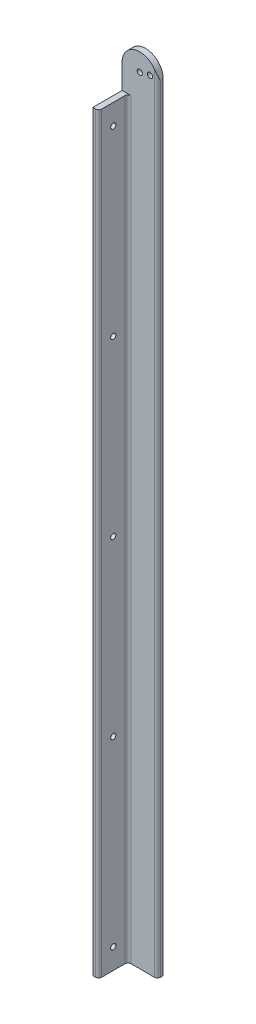
from build123d import *

# Parameters (mm, degrees)
BOSS_EXTRUDE1_DEPTH = 431.8
SKETCH4_W           = 15.875
SKETCH4_H           = 25.4
CUT_EXTRUDE1_DEPTH  = 6.35
SKETCH5_W           = 1.5875
SKETCH5_H           = 25.4
CUT_EXTRUDE2_DEPTH  = 6.35
SKETCH6_R           = 1.4224
CUT_EXTRUDE3_DEPTH  = 5.08
CUT_EXTRUDE4_START  = -2.54
CUT_EXTRUDE4_DEPTH  = 2.54
SKETCH8_R           = 1.4224
CUT_EXTRUDE5_DEPTH  = 5.08
SKETCH9_W           = 28.861002292
SKETCH9_H           = 547.524656259
CUT_EXTRUDE6_DEPTH  = 30.48
CUT_EXTRUDE7_DEPTH  = 5.08


with BuildPart() as part:
    # Sketch2 → Boss-Extrude1 (new body)
    with BuildSketch(Plane(origin=(0, 0, 0), x_dir=(1, 0, 0), z_dir=(0, 1, 0))):
        with BuildLine():
            Line((0, 0), (19.05, 0))
            Line((19.05, 0), (19.05, 1.5875))
            ThreePointArc((19.05, 1.5875), (18.585032015, 2.710032015), (17.4625, 3.175))
            Line((17.4625, 3.175), (4.7625, 3.175))
            ThreePointArc((4.7625, 3.175), (3.639967985, 3.639967985), (3.175, 4.7625))
            Line((3.175, 4.7625), (3.175, 17.4625))
            ThreePointArc((3.175, 17.4625), (2.710032015, 18.585032015), (1.5875, 19.05))
            Line((1.5875, 19.05), (0, 19.05))
            Line((0, 19.05), (0, 0))
        make_face()
    extrude(amount=BOSS_EXTRUDE1_DEPTH)

    # Sketch4 → Cut-Extrude1 (cut)
    with BuildSketch(Plane(origin=(3.175, 0, 0), x_dir=(0, 0, -1), z_dir=(1, 0, 0))):
        with Locations((11.1125, 419.1)):
            Rectangle(SKETCH4_W, SKETCH4_H)
    extrude(amount=-CUT_EXTRUDE1_DEPTH, mode=Mode.SUBTRACT)

    # Sketch5 → Cut-Extrude2 (cut)
    with BuildSketch(Plane.ZY.offset(-3.175)):
        with Locations((-3.96875, 419.1)):
            Rectangle(SKETCH5_W, SKETCH5_H)
    extrude(amount=-CUT_EXTRUDE2_DEPTH, mode=Mode.SUBTRACT)

    # Sketch6 → Cut-Extrude3 (cut)
    with BuildSketch(Plane(origin=(3.175, 0, 0), x_dir=(0, 0, -1), z_dir=(1, 0, 0))):
        with Locations((11.1125, 109.5375)):
            Circle(SKETCH6_R)
        with Locations((11.1125, 203.2)):
            Circle(SKETCH6_R)
        with Locations((11.1125, 296.8625)):
            Circle(SKETCH6_R)
        with Locations((11.1125, 11.1125)):
            Circle(SKETCH6_R)
        with Locations((11.1125, 395.2875)):
            Circle(SKETCH6_R)
    extrude(amount=-CUT_EXTRUDE3_DEPTH, mode=Mode.SUBTRACT)

    # Sketch7 → Cut-Extrude4 (cut)
    with BuildSketch(Plane(origin=(0, 431.8, 0), x_dir=(1, 0, 0), z_dir=(0, 1, 0)).offset(CUT_EXTRUDE4_START)):
        with BuildLine():
            Line((17.4625, 3.175), (0, 3.175))
            Line((0, 3.175), (0, 0))
            Line((0, 0), (19.05, 0))
            Line((19.05, 0), (19.05, 1.5875))
            ThreePointArc((19.05, 1.5875), (18.585032015, 2.710032015), (17.4625, 3.175))
        make_face()
    extrude(amount=CUT_EXTRUDE4_DEPTH, mode=Mode.SUBTRACT)

    # Sketch8 → Cut-Extrude5 (cut)
    with BuildSketch(Plane(origin=(0, 0, -3.175), x_dir=(-1, 0, 0), z_dir=(0, 0, -1))):
        with Locations((-9.525, 419.735)):
            Circle(SKETCH8_R)
        with Locations((-15.09352492, 421.020595276)):
            Circle(SKETCH8_R)
    extrude(amount=-CUT_EXTRUDE5_DEPTH, mode=Mode.SUBTRACT)


with BuildPart() as body_2:
    # Mirror3: mirrored copy
    add(part.part.mirror(Plane.XY.offset(2.54)))

    # Sketch10 → Cut-Extrude7 (cut)
    with BuildSketch(Plane.XY.offset(8.255)):
        with BuildLine():
            Line((19.05, 419.735), (19.05, 429.26))
            Line((19.05, 429.26), (9.525, 429.26))
            ThreePointArc((9.525, 429.26), (16.260192091, 426.470192091), (19.05, 419.735))
        make_face()
        with BuildLine():
            ThreePointArc((0, 419.735), (2.789807909, 426.470192091), (9.525, 429.26))
            Line((9.525, 429.26), (0, 429.26))
            Line((0, 429.26), (0, 419.735))
        make_face()
    extrude(amount=-CUT_EXTRUDE7_DEPTH, mode=Mode.SUBTRACT)


with BuildPart() as part_1:
    add(part.part)

    # Sketch9 → Cut-Extrude6 (cut)
    with BuildSketch(Plane.XY.offset(2.54)):
        with Locations((7.805746781, 195.778589833)):
            Rectangle(SKETCH9_W, SKETCH9_H)
    extrude(amount=-CUT_EXTRUDE6_DEPTH, mode=Mode.SUBTRACT)


solid = body_2.part
